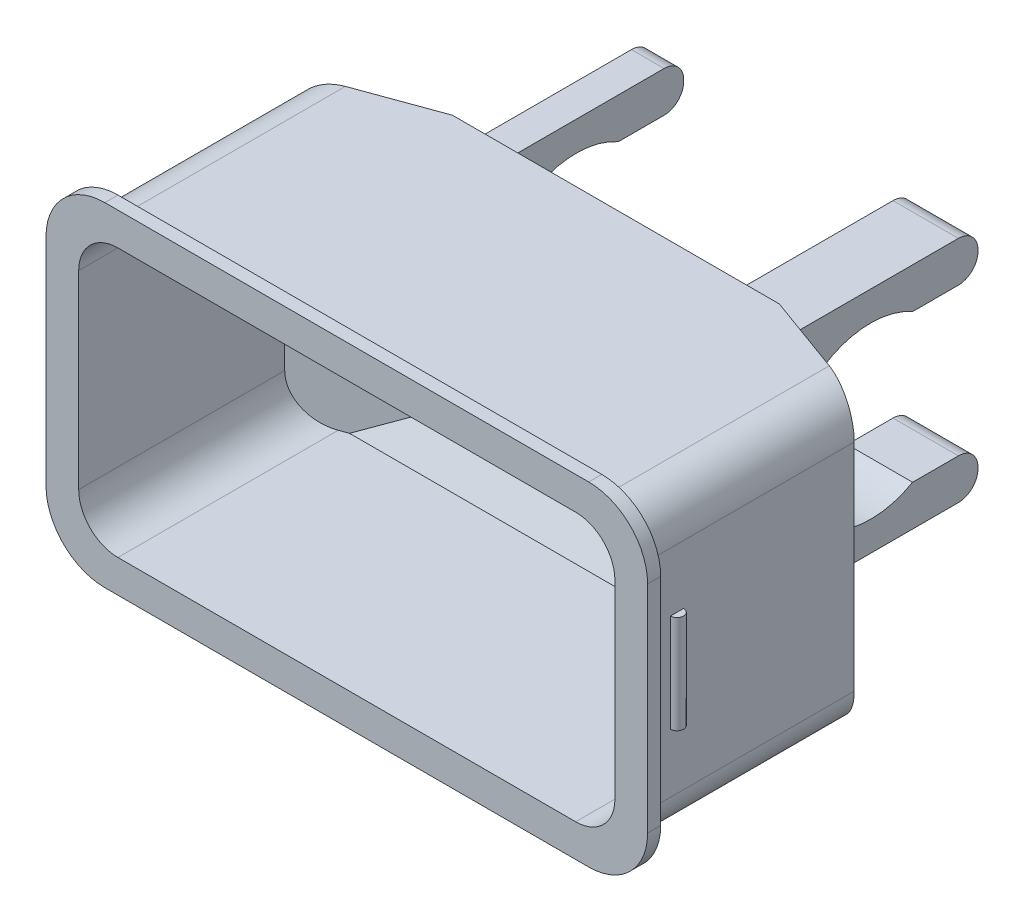
from build123d import *
from OCP.BRepFilletAPI import BRepFilletAPI_MakeChamfer

# Parameters (mm, degrees)
SKETCH1_W           = 86
SKETCH1_H           = 45
SKETCH1_W_2         = 82
SKETCH1_H_2         = 41
BOSS_EXTRUDE1_DEPTH = 39.15
SKETCH2_W           = 86
SKETCH2_H           = 45
BOSS_EXTRUDE2_DEPTH = 2
BOSS_EXTRUDE3_DEPTH = 10
BOSS_EXTRUDE4_START = -5
BOSS_EXTRUDE4_DEPTH = 5
FILLET2_R           = 3
SKETCH5_W           = 35
SKETCH5_H           = 28
CUT_EXTRUDE1_DEPTH  = 5
BOSS_EXTRUDE5_REACH = 94.369
CHAMFER1_SIZE       = 8.660254038
CHAMFER1_SIZE_2     = 5
CHAMFER2_SIZE       = 6.551464217
CHAMFER2_SIZE_2     = 18
FILLET3_R           = 6
BOSS_EXTRUDE6_DEPTH = 2
BOSS_EXTRUDE7_DEPTH = 15


# Some blends are built 0.0001 mm under size
with BuildPart() as part:
    # Sketch1 → Boss-Extrude1 (new body)
    with BuildSketch(Plane.XY):
        Rectangle(SKETCH1_W, SKETCH1_H)
        Rectangle(SKETCH1_W_2, SKETCH1_H_2, mode=Mode.SUBTRACT)
    extrude(amount=-BOSS_EXTRUDE1_DEPTH)

    # Sketch2 → Boss-Extrude2 (add)
    with BuildSketch(Plane(origin=(0, 0, -39.15), x_dir=(-1, 0, 0), z_dir=(0, 0, -1))):
        Rectangle(SKETCH2_W, SKETCH2_H)
    extrude(amount=-BOSS_EXTRUDE2_DEPTH)

    # Sketch3 → Boss-Extrude3 (add)
    with BuildSketch(Plane(origin=(25, 0, 0), x_dir=(0, 0, -1), z_dir=(1, 0, 0))):
        with BuildLine():
            Line((69.527285586, 11.3), (69.527285586, 17.5))
            Line((69.527285586, 17.5), (39.15, 17.5))
            Line((39.15, 17.5), (39.15, -17.5))
            Line((39.15, -17.5), (69.527285586, -17.5))
            Line((69.527285586, -17.5), (69.527285586, -11.3))
            Line((69.527285586, -11.3), (59.527285586, -11.3))
            ThreePointArc((59.527285586, -11.3), (40.1, 0), (59.527285586, 11.3))
            Line((59.527285586, 11.3), (69.527285586, 11.3))
        make_face()
    extrude(amount=-BOSS_EXTRUDE3_DEPTH)

    # Sketch4 → Boss-Extrude4 (add)
    with BuildSketch(Plane.ZY.offset(25).offset(BOSS_EXTRUDE4_START)):
        with BuildLine():
            Line((-39.15, -17.5), (-39.15, 17.5))
            Line((-39.15, 17.5), (-69.527285586, 17.5))
            Line((-69.527285586, 17.5), (-69.527285586, 11.3))
            Line((-69.527285586, 11.3), (-59.527285586, 11.3))
            ThreePointArc((-59.527285586, 11.3), (-40.1, 0), (-59.527285586, -11.3))
            Line((-59.527285586, -11.3), (-69.527285586, -11.3))
            Line((-69.527285586, -11.3), (-69.527285586, -17.5))
            Line((-69.527285586, -17.5), (-39.15, -17.5))
        make_face()
    extrude(amount=BOSS_EXTRUDE4_DEPTH)

    # Fillet2
    fillet2_edges = [part.edges().sort_by_distance(p)[0] for p in [
        (20, -11.3, -69.527285586),
        (20, -17.5, -69.527285586),
        (20, -17.5, -39.15),
        (20, 17.5, -39.15),
        (20, 17.5, -69.527285586),
        (20, 11.3, -69.527285586),
        (-22.5, -17.5, -39.15),
        (-22.5, -17.5, -69.527285586),
        (-22.5, -11.3, -69.527285586),
        (-22.5, 11.3, -69.527285586),
        (-22.5, 17.5, -69.527285586),
        (-22.5, 17.5, -39.15),
    ]]
    fillet(fillet2_edges, radius=FILLET2_R)

    # Sketch5 → Cut-Extrude1 (cut)
    with BuildSketch(Plane(origin=(0, 0, -39.15), x_dir=(-1, 0, 0), z_dir=(0, 0, -1))):
        with Locations((2.5, 0)):
            Rectangle(SKETCH5_W, SKETCH5_H)
    extrude(amount=-CUT_EXTRUDE1_DEPTH, mode=Mode.SUBTRACT)

    # Boss-Extrude5: up to this face of the body (flat: up to its plane)
    boss_extrude5_end = Plane(part.part.faces().sort_by_distance((0, 20.5, -18.575))[0])
    # Sketch6 → Boss-Extrude5 (add, up to the picked face)
    with BuildSketch(Plane(origin=(0, -20.5, 0), x_dir=(1, 0, 0), z_dir=(0, 1, 0)), mode=Mode.PRIVATE) as boss_extrude5_sk1:
        Polygon((-20, 37.15), (-43, 28.778684612), (-43, 37.15), align=None)
    boss_extrude5_tool1 = split(extrude(boss_extrude5_sk1.sketch, amount=BOSS_EXTRUDE5_REACH, mode=Mode.PRIVATE), bisect_by=boss_extrude5_end, keep=Keep.BOTH, mode=Mode.PRIVATE)
    # Sketch6 → Boss-Extrude5 (add, up to the picked face)
    with BuildSketch(Plane(origin=(0, -20.5, 0), x_dir=(1, 0, 0), z_dir=(0, 1, 0)), mode=Mode.PRIVATE) as boss_extrude5_sk2:
        Polygon((15, 37.15), (43, 37.15), (43, 28.778684612), align=None)
    boss_extrude5_tool2 = split(extrude(boss_extrude5_sk2.sketch, amount=BOSS_EXTRUDE5_REACH, mode=Mode.PRIVATE), bisect_by=boss_extrude5_end, keep=Keep.BOTH, mode=Mode.PRIVATE)
    add(boss_extrude5_tool1.solids().sort_by(Axis((-35.333333, -20.5, -34.359562), (0, 1, 0)))[0])
    add(boss_extrude5_tool2.solids().sort_by(Axis((33.666667, -20.5, -34.359562), (0, 1, 0)))[0])

    # Chamfer1
    # the kernel refuses this chamfer: 8.660254038, 5 mm, written as the material it adds along each edge
    with BuildSketch(Plane(origin=(-42.404819853, 20.5, -37.15), x_dir=(0, -0.999813220622208, -0.019326765612700494), z_dir=(1, 0, 0))) as chamfer1_piece_1_section:
        Polygon((CHAMFER1_SIZE * 0.999813220604, -CHAMFER1_SIZE * 0.0193267656124), (-CHAMFER1_SIZE_2 * 0.0193267656127, -CHAMFER1_SIZE_2 * 0.999813220622), (0, 0), align=None)
    chamfer1_piece_1 = extrude(amount=79.809639706, mode=Mode.PRIVATE)
    chamfer1_piece_1 = split(chamfer1_piece_1, bisect_by=Plane(origin=(-20, 13.459936491, -36.526388375), z_dir=(-1, 0, 0)), keep=Keep.TOP, mode=Mode.PRIVATE)
    add(chamfer1_piece_1)
    with BuildSketch(Plane(origin=(-42.404819853, 20.5, -37.15), x_dir=(0, -0.999813220622208, -0.019326765612700494), z_dir=(1, 0, 0))) as chamfer1_piece_2_section:
        Polygon((CHAMFER1_SIZE * 0.999813220604, -CHAMFER1_SIZE * 0.0193267656124), (-CHAMFER1_SIZE_2 * 0.0193267656127, -CHAMFER1_SIZE_2 * 0.999813220622), (0, 0), align=None)
    chamfer1_piece_2 = extrude(amount=79.809639706, mode=Mode.PRIVATE)
    chamfer1_piece_2 = split(chamfer1_piece_2, bisect_by=Plane(origin=(-2.5, 14, -35.400332947), z_dir=(0, 1, 0)), keep=Keep.TOP, mode=Mode.PRIVATE)
    add(chamfer1_piece_2)
    with BuildSketch(Plane(origin=(-42.404819853, 20.5, -37.15), x_dir=(0, -0.999813220622208, -0.019326765612700494), z_dir=(1, 0, 0))) as chamfer1_piece_3_section:
        Polygon((CHAMFER1_SIZE * 0.999813220604, -CHAMFER1_SIZE * 0.0193267656124), (-CHAMFER1_SIZE_2 * 0.0193267656127, -CHAMFER1_SIZE_2 * 0.999813220622), (0, 0), align=None)
    chamfer1_piece_3 = extrude(amount=79.809639706, mode=Mode.PRIVATE)
    chamfer1_piece_3 = split(chamfer1_piece_3, bisect_by=Plane(origin=(15, 13.459936491, -36.526388375), z_dir=(1, 0, 0)), keep=Keep.TOP, mode=Mode.PRIVATE)
    add(chamfer1_piece_3)
    with BuildSketch(Plane(origin=(37.404819853, -20.5, -37.15), x_dir=(0, 0.999813220622208, -0.019326765612700494), z_dir=(-1, 0, 0))) as chamfer1_piece_4_section:
        Polygon((CHAMFER1_SIZE * 0.999813220604, -CHAMFER1_SIZE * 0.0193267656124), (-CHAMFER1_SIZE_2 * 0.0193267656127, -CHAMFER1_SIZE_2 * 0.999813220622), (0, 0), align=None)
    chamfer1_piece_4 = extrude(amount=79.809639706, mode=Mode.PRIVATE)
    chamfer1_piece_4 = split(chamfer1_piece_4, bisect_by=Plane(origin=(15, -13.459936491, -36.526388375), z_dir=(1, 0, 0)), keep=Keep.TOP, mode=Mode.PRIVATE)
    add(chamfer1_piece_4)
    with BuildSketch(Plane(origin=(37.404819853, -20.5, -37.15), x_dir=(0, 0.999813220622208, -0.019326765612700494), z_dir=(-1, 0, 0))) as chamfer1_piece_5_section:
        Polygon((CHAMFER1_SIZE * 0.999813220604, -CHAMFER1_SIZE * 0.0193267656124), (-CHAMFER1_SIZE_2 * 0.0193267656127, -CHAMFER1_SIZE_2 * 0.999813220622), (0, 0), align=None)
    chamfer1_piece_5 = extrude(amount=79.809639706, mode=Mode.PRIVATE)
    chamfer1_piece_5 = split(chamfer1_piece_5, bisect_by=Plane(origin=(-2.5, -14, -35.400332947), z_dir=(0, -1, 0)), keep=Keep.TOP, mode=Mode.PRIVATE)
    add(chamfer1_piece_5)
    with BuildSketch(Plane(origin=(37.404819853, -20.5, -37.15), x_dir=(0, 0.999813220622208, -0.019326765612700494), z_dir=(-1, 0, 0))) as chamfer1_piece_6_section:
        Polygon((CHAMFER1_SIZE * 0.999813220604, -CHAMFER1_SIZE * 0.0193267656124), (-CHAMFER1_SIZE_2 * 0.0193267656127, -CHAMFER1_SIZE_2 * 0.999813220622), (0, 0), align=None)
    chamfer1_piece_6 = extrude(amount=79.809639706, mode=Mode.PRIVATE)
    chamfer1_piece_6 = split(chamfer1_piece_6, bisect_by=Plane(origin=(-20, -13.459936491, -36.526388375), z_dir=(-1, 0, 0)), keep=Keep.TOP, mode=Mode.PRIVATE)
    add(chamfer1_piece_6)

    # Chamfer2
    chamfer2_edges_1 = [part.edges().sort_by_distance(p)[0] for p in [
        (-43, 0, -39.15),
    ]]
    chamfer2_side_1 = [part.faces().sort_by_distance(p)[0] for p in [
        (-43, 0, -39.018970716),
    ]]
    chamfer2_edges_2 = [part.edges().sort_by_distance(p)[0] for p in [
        (43, 0, -39.15),
    ]]
    chamfer2_side_2 = [part.faces().sort_by_distance(p)[0] for p in [
        (42.868970716, 0, -39.15),
    ]]
    chamfer2 = BRepFilletAPI_MakeChamfer(part.part.solid().wrapped)
    for e in chamfer2_edges_1:
        chamfer2.Add(CHAMFER2_SIZE - 0.0001, CHAMFER2_SIZE_2 - 0.0001, e.wrapped, chamfer2_side_1[0].wrapped)
    for e in chamfer2_edges_2:
        chamfer2.Add(CHAMFER2_SIZE_2 - 0.0001, CHAMFER2_SIZE - 0.0001, e.wrapped, chamfer2_side_2[0].wrapped)
    add(Compound.cast(chamfer2.Shape()), mode=Mode.REPLACE)  # a hair under: the kernel refuses the full size

    # Fillet3
    fillet3_edges = [part.edges().sort_by_distance(p)[0] for p in [
        (41, -20.5, -14.688317856),
        (41, 20.5, -14.688317856),
        (-41, 20.5, -14.75331254),
        (-41, -20.5, -14.75331254),
        (-43, -22.5, -16.299317891),
        (-43, 22.5, -16.299317891),
        (43, -22.5, -16.299317891),
        (43, 22.5, -16.299317891),
    ]]
    fillet(fillet3_edges, radius=FILLET3_R)

    # Sketch7 → Boss-Extrude6 (add)
    # profile 1 of 2: a face of its own
    with BuildSketch(Plane.XY):
        with BuildLine():
            Line((46, -16.5), (46, 16.5))
            ThreePointArc((46, 16.5), (43.363961031, 22.863961031), (37, 25.5))
            Line((37, 25.5), (-37, 25.5))
            ThreePointArc((-37, 25.5), (-43.363961031, 22.863961031), (-46, 16.5))
            Line((-46, 16.5), (-46, -16.5))
            ThreePointArc((-46, -16.5), (-43.363961031, -22.863961031), (-37, -25.5))
            Line((-37, -25.5), (37, -25.5))
            ThreePointArc((37, -25.5), (43.363961031, -22.863961031), (46, -16.5))
        make_face()
        with BuildLine():
            Line((37, 22.5), (-37, 22.5))
            ThreePointArc((-37, 22.5), (-41.242640687, 20.742640687), (-43, 16.5))
            Line((-43, 16.5), (-43, -16.5))
            ThreePointArc((-43, -16.5), (-41.242640687, -20.742640687), (-37, -22.5))
            Line((-37, -22.5), (37, -22.5))
            ThreePointArc((37, -22.5), (41.242640687, -20.742640687), (43, -16.5))
            Line((43, -16.5), (43, 16.5))
            ThreePointArc((43, 16.5), (41.242640687, 20.742640687), (37, 22.5))
        make_face(mode=Mode.SUBTRACT)
    # profile 2 of 2: a face of its own
    with BuildSketch(Plane.XY):
        with BuildLine():
            ThreePointArc((43, 16.5), (41.242640687, 20.742640687), (37, 22.5))
            Line((37, 22.5), (-37, 22.5))
            ThreePointArc((-37, 22.5), (-41.242640687, 20.742640687), (-43, 16.5))
            Line((-43, 16.5), (-43, -16.5))
            ThreePointArc((-43, -16.5), (-41.242640687, -20.742640687), (-37, -22.5))
            Line((-37, -22.5), (37, -22.5))
            ThreePointArc((37, -22.5), (41.242640687, -20.742640687), (43, -16.5))
            Line((43, -16.5), (43, 16.5))
        make_face()
        with BuildLine():
            ThreePointArc((35, 20.5), (39.242640687, 18.742640687), (41, 14.5))
            Line((41, 14.5), (41, -14.5))
            ThreePointArc((41, -14.5), (39.242640687, -18.742640687), (35, -20.5))
            Line((35, -20.5), (-35, -20.5))
            ThreePointArc((-35, -20.5), (-39.242640687, -18.742640687), (-41, -14.5))
            Line((-41, -14.5), (-41, 14.5))
            ThreePointArc((-41, 14.5), (-39.242640687, 18.742640687), (-35, 20.5))
            Line((-35, 20.5), (35, 20.5))
        make_face(mode=Mode.SUBTRACT)
    extrude(amount=BOSS_EXTRUDE6_DEPTH)

    # Sketch9 → Boss-Extrude7 (add)
    with BuildSketch(Plane(origin=(0, -7.5, 0), x_dir=(-1, 0, 0), z_dir=(0, -1, 0))):
        with BuildLine():
            ThreePointArc((44, 5.5), (43.707106781, 6.207106781), (43, 6.5))
            Line((43, 6.5), (43, 4.5))
            ThreePointArc((43, 4.5), (43.707106781, 4.792893219), (44, 5.5))
        make_face()
        with BuildLine():
            Line((43, 4.5), (43, 6.5))
            ThreePointArc((43, 6.5), (42, 5.5), (43, 4.5))
        make_face()
        with BuildLine():
            ThreePointArc((-43, 6.5), (-44, 5.5), (-43, 4.5))
            Line((-43, 4.5), (-43, 6.5))
        make_face()
        with BuildLine():
            Line((-43, 6.5), (-43, 4.5))
            ThreePointArc((-43, 4.5), (-42.292893219, 4.792893219), (-42, 5.5))
            ThreePointArc((-42, 5.5), (-42.292893219, 6.207106781), (-43, 6.5))
        make_face()
    extrude(amount=-BOSS_EXTRUDE7_DEPTH)


solid = part.part
